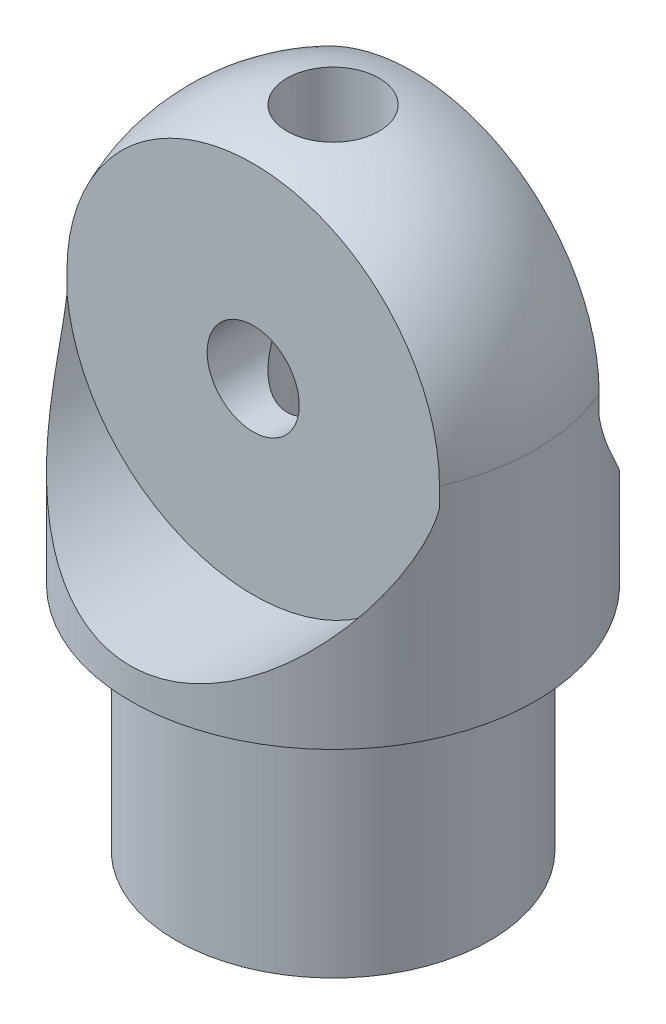
from build123d import *

# Parameters (mm, degrees)
SKETCH1_R               = 12.9794
BOSS_EXTRUDE1_DEPTH     = 19.05
CUT_EXTRUDE1_DEPTH      = 59.815433775
CUT_EXTRUDE1_DEPTH_BACK = 59.815433775
SKETCH4_R               = 3.81
SKETCH5_R               = 15.494
CUT_EXTRUDE2_DEPTH      = 28.194
SKETCH6_R               = 3.81
CUT_EXTRUDE3_DEPTH      = 37.642966565
SKETCH6_3_R             = 1.905
CUT_EXTRUDE4_DEPTH      = 37.642966565


with BuildPart() as part:
    # Sketch1 → Boss-Extrude1 (new body)
    with BuildSketch(Plane(origin=(0, 0, 0), x_dir=(1, 0, 0), z_dir=(0, 1, 0))):
        Circle(SKETCH1_R)
    extrude(amount=BOSS_EXTRUDE1_DEPTH)

    # Sketch2 → Revolve1 (revolve)
    with BuildSketch(Plane(origin=(0, 0, 0), x_dir=(0, 0, -1), z_dir=(1, 0, 0))):
        with BuildLine():
            Line((0, 19.05), (0, 53.825568814))
            ThreePointArc((0, 53.825568814), (-11.85393808, 48.915506894), (-16.764, 37.061568814))
            Line((-16.764, 37.061568814), (-16.764, 19.05))
            Line((-16.764, 19.05), (0, 19.05))
        make_face()
    revolve(axis=Axis((0, 19.05, 0), (0, 1, 0)))

    # Sketch4 → Cut-Extrude1 (cut, two sides: drawn at the far end of the back side and taken through both)
    with BuildSketch(Plane.XY.offset(-CUT_EXTRUDE1_DEPTH_BACK)):
        with Locations((0, 37.061568814)):
            Circle(SKETCH4_R)
    extrude(amount=CUT_EXTRUDE1_DEPTH + CUT_EXTRUDE1_DEPTH_BACK, mode=Mode.SUBTRACT)

    # Sketch5 → Cut-Extrude2 (cut)
    with BuildSketch(Plane.XY.offset(-6.604)):
        with Locations((0, 37.061568814)):
            Circle(SKETCH5_R)
    cut_extrude2 = extrude(amount=-CUT_EXTRUDE2_DEPTH, mode=Mode.SUBTRACT)

    # Mirror1: Cut-Extrude2 across plane
    add(cut_extrude2.mirror(Plane.XY), mode=Mode.SUBTRACT)

    # Sketch6 → Cut-Extrude3 (cut, through all)
    with BuildSketch(Plane(origin=(0, 27.94, 0), x_dir=(1, 0, 0), z_dir=(0, 1, 0))):
        Circle(SKETCH6_R)
    extrude(amount=CUT_EXTRUDE3_DEPTH, mode=Mode.SUBTRACT)

    # Sketch6<3> → Cut-Extrude4 (cut, through all)
    with BuildSketch(Plane(origin=(0, 27.94, 0), x_dir=(1, 0, 0), z_dir=(0, 1, 0))):
        Circle(SKETCH6_3_R)
    extrude(amount=-CUT_EXTRUDE4_DEPTH, mode=Mode.SUBTRACT)


solid = part.part
